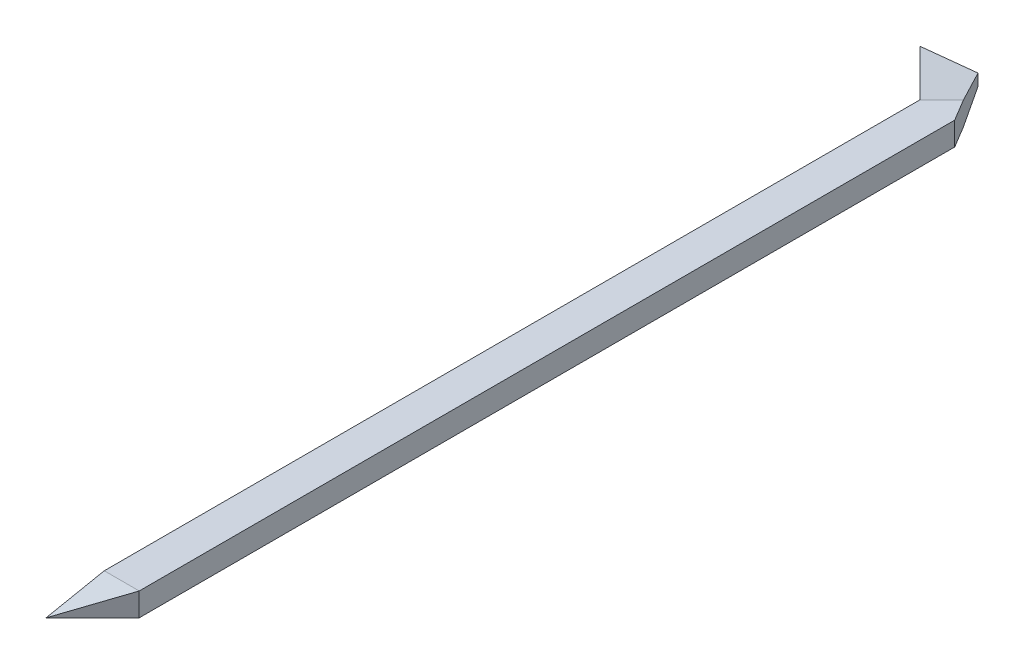
from build123d import *

# Parameters (mm, degrees)
BOSS_EXTRUDE1_DEPTH     = 5.08
CUT_EXTRUDE1_DEPTH      = 104.736535512
CUT_EXTRUDE1_DEPTH_BACK = 104.736535512
CUT_EXTRUDE2_DEPTH      = 157.915682454
CUT_EXTRUDE2_DEPTH_BACK = 157.915682454


with BuildPart() as part:
    # Sketch1 → Boss-Extrude1 (new body)
    with BuildSketch(Plane(origin=(0, 0, 0), x_dir=(1, 0, 0), z_dir=(0, 1, 0))):
        Polygon((7.62, 88.9), (0, 101.6), (-12.7, 101.6), (0, 88.9), (0, -101.6), (7.62, -88.9), align=None)
    extrude(amount=BOSS_EXTRUDE1_DEPTH)

    # Sketch2 → Cut-Extrude1 (cut, two sides: drawn at the far end of the back side and taken through both)
    with BuildSketch(Plane(origin=(7.62, 0, 0), x_dir=(0, 0, -1), z_dir=(1, 0, 0)).offset(-CUT_EXTRUDE1_DEPTH_BACK)):
        Polygon((-88.9, 0), (-101.6, 2.54), (-101.6, 0), align=None)
        Polygon((-101.6, 2.54), (-88.9, 5.08), (-101.6, 5.08), align=None)
    extrude(amount=CUT_EXTRUDE1_DEPTH + CUT_EXTRUDE1_DEPTH_BACK, mode=Mode.SUBTRACT)

    # Sketch3 → Cut-Extrude2 (cut, two sides: drawn at the far end of the back side and taken through both)
    with BuildSketch(Plane(origin=(44.45, 0, -44.45), x_dir=(0.707106781186556, 0, 0.7071067811865391), z_dir=(-0.7071067811865391, 0, 0.707106781186556)).offset(-CUT_EXTRUDE2_DEPTH_BACK)):
        Polygon((-62.861792847, 0), (-80.82230509, 2.54), (-80.82230509, 0), align=None)
        Polygon((-80.82230509, 2.54), (-62.861792847, 5.08), (-80.82230509, 5.08), align=None)
    extrude(amount=CUT_EXTRUDE2_DEPTH + CUT_EXTRUDE2_DEPTH_BACK, mode=Mode.SUBTRACT)


solid = part.part
